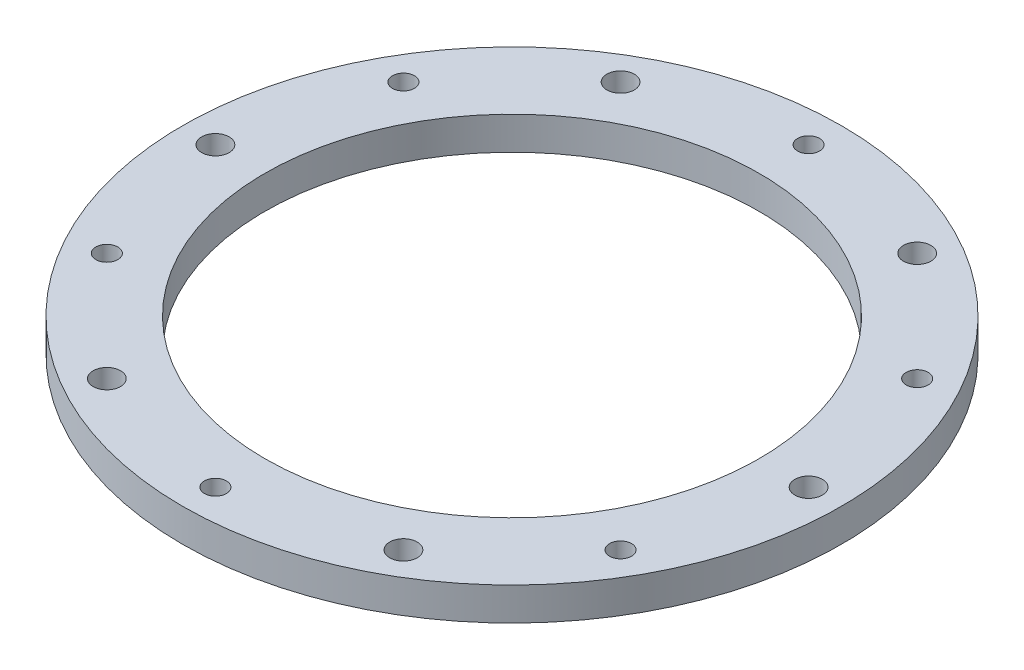
from build123d import *

# Parameters (mm, degrees)
SKETCH1_R           = 30
SKETCH1_R_2         = 1
SKETCH1_R_3         = 22.5
BOSS_EXTRUDE1_DEPTH = 3
SKETCH3_R           = 1.25
CUT_EXTRUDE1_DEPTH  = 3


with BuildPart() as part:
    # Sketch1 → Boss-Extrude1 (new body)
    with BuildSketch(Plane(origin=(0, 0, 0), x_dir=(1, 0, 0), z_dir=(0, 1, 0))):
        Circle(SKETCH1_R)
        with Locations((0, 27)):
            Circle(SKETCH1_R_2, mode=Mode.SUBTRACT)
        with Locations((23.382685902, 13.5)):
            Circle(SKETCH1_R_2, mode=Mode.SUBTRACT)
        with Locations((23.382685902, -13.5)):
            Circle(SKETCH1_R_2, mode=Mode.SUBTRACT)
        with Locations((0, -27)):
            Circle(SKETCH1_R_2, mode=Mode.SUBTRACT)
        with Locations((-23.382685902, -13.5)):
            Circle(SKETCH1_R_2, mode=Mode.SUBTRACT)
        with Locations((-23.382685902, 13.5)):
            Circle(SKETCH1_R_2, mode=Mode.SUBTRACT)
        Circle(SKETCH1_R_3, mode=Mode.SUBTRACT)
    extrude(amount=BOSS_EXTRUDE1_DEPTH)

    # Sketch3 → Cut-Extrude1 (cut)
    with BuildSketch(Plane(origin=(0, 3, 0), x_dir=(1, 0, 0), z_dir=(0, 1, 0))):
        with Locations((-13.5, 23.382685902)):
            Circle(SKETCH3_R)
        with Locations((13.5, 23.382685902)):
            Circle(SKETCH3_R)
        with Locations((27, 0)):
            Circle(SKETCH3_R)
        with Locations((13.5, -23.382685902)):
            Circle(SKETCH3_R)
        with Locations((-13.5, -23.382685902)):
            Circle(SKETCH3_R)
        with Locations((-27, 0)):
            Circle(SKETCH3_R)
    extrude(amount=-CUT_EXTRUDE1_DEPTH, mode=Mode.SUBTRACT)


solid = part.part
